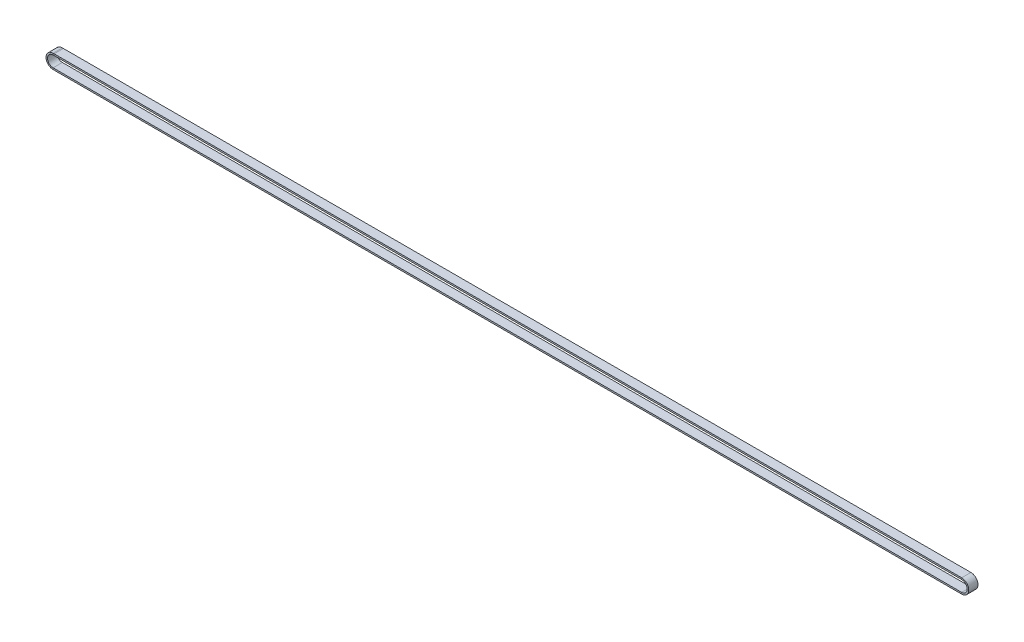
from build123d import *

# Parameters (mm, degrees)
SKETCH3_W = 9
SKETCH3_H = 1.5


with BuildPart() as part:
    # Sweep1: sweep along a path in Sketch2
    with BuildLine(Plane.XY) as sweep1_path:
        Line((-1, -38.085878999), (883.52063792, -38.085878999))
        ThreePointArc((883.52063792, -38.085878999), (890.42063792, -44.985878999), (883.52063792, -51.885878999))
        Line((883.52063792, -51.885878999), (-1, -51.885878999))
        ThreePointArc((-1, -51.885878999), (-7.9, -44.985878999), (-1, -38.085878999))
    # Sketch3 → Sweep1 (sweep)
    with BuildSketch(Plane(origin=(0, 0, 0), x_dir=(0, 0, -1), z_dir=(1, 0, 0))):
        with Locations((-4.5, -38.835878999)):
            Rectangle(SKETCH3_W, SKETCH3_H)
    sweep(path=sweep1_path.line)


solid = part.part
